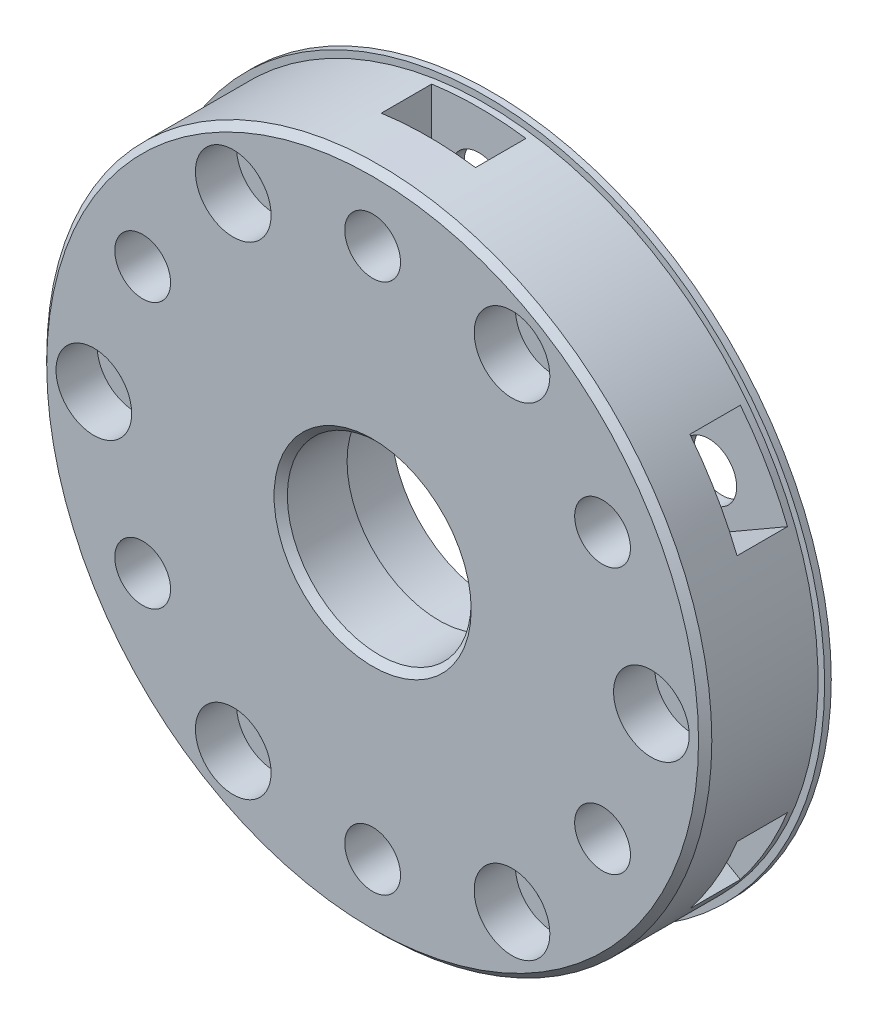
from build123d import *

# Parameters (mm, degrees)
OUTPUT_MASTER_SKETCH_R  = 25.05
BOSS_EXTRUDE1_DEPTH     = 9
SKETCH4_R               = 2.85
CUT_EXTRUDE1_DEPTH      = 4
SKETCH5_R               = 25.55
SKETCH5_R_2             = 25.05
BOSS_EXTRUDE2_DEPTH     = 0.5
SKETCH6_R               = 1.55
CUT_EXTRUDE2_DEPTH      = 38.237145433
CUT_EXTRUDE3_START      = -3.1
SKETCH7_R               = 2.85
CUT_EXTRUDE3_DEPTH      = 3.1
CHAMFER1_SIZE           = 0.5
SKETCH8_R               = 6.925
CUT_EXTRUDE4_DEPTH      = 10
SKETCH9_R               = 7.575
CUT_EXTRUDE5_DEPTH      = 4
SKETCH10_R              = 2.1
M4_THRU_DEPTH           = 38.237145433
CHAMFER3_SIZE           = 0.5
M4_START                = -8
M4_HEXNUT_CUT_DEPTH     = 3.8
SKETCH12_W              = 7.1
SKETCH12_H              = 3.8
M4_HEXNUT_SLOT_DEPTH    = 55.767908461
M4_HEXNUT_PATTERN_COUNT = 6


with BuildPart() as part:
    # Output Master Sketch → Boss-Extrude1 (new body)
    with BuildSketch(Plane.XY):
        Circle(OUTPUT_MASTER_SKETCH_R)
    extrude(amount=BOSS_EXTRUDE1_DEPTH)

    # Sketch4 → Cut-Extrude1 (cut)
    with BuildSketch(Plane.XY):
        with Locations((21, 0)):
            Circle(SKETCH4_R)
        with Locations((10.5, -18.186533479)):
            Circle(SKETCH4_R)
        with Locations((-10.5, -18.186533479)):
            Circle(SKETCH4_R)
        with Locations((-21, 0)):
            Circle(SKETCH4_R)
        with Locations((-10.5, 18.186533479)):
            Circle(SKETCH4_R)
        with Locations((10.5, 18.186533479)):
            Circle(SKETCH4_R)
    extrude(amount=CUT_EXTRUDE1_DEPTH, mode=Mode.SUBTRACT)

    # Sketch5 → Boss-Extrude2 (add)
    with BuildSketch(Plane(origin=(0, 0, 0), x_dir=(-1, 0, 0), z_dir=(0, 0, -1))):
        Circle(SKETCH5_R)
        Circle(SKETCH5_R_2, mode=Mode.SUBTRACT)
    extrude(amount=-BOSS_EXTRUDE2_DEPTH)

    # Sketch6 → Cut-Extrude2 (cut, through all)
    with BuildSketch(Plane(origin=(0, 0, 0), x_dir=(-1, 0, 0), z_dir=(0, 0, -1))):
        with Locations((-21, 0)):
            Circle(SKETCH6_R)
        with Locations((-10.5, 18.186533479)):
            Circle(SKETCH6_R)
        with Locations((10.5, 18.186533479)):
            Circle(SKETCH6_R)
        with Locations((21, 0)):
            Circle(SKETCH6_R)
        with Locations((10.5, -18.186533479)):
            Circle(SKETCH6_R)
        with Locations((-10.5, -18.186533479)):
            Circle(SKETCH6_R)
    extrude(amount=-CUT_EXTRUDE2_DEPTH, mode=Mode.SUBTRACT)

    # Sketch7 → Cut-Extrude3 (cut)
    with BuildSketch(Plane.XY.offset(9).offset(CUT_EXTRUDE3_START)):
        with Locations((-21, 0)):
            Circle(SKETCH7_R)
        with Locations((-10.5, 18.186533479)):
            Circle(SKETCH7_R)
        with Locations((10.5, 18.186533479)):
            Circle(SKETCH7_R)
        with Locations((21, 0)):
            Circle(SKETCH7_R)
        with Locations((10.5, -18.186533479)):
            Circle(SKETCH7_R)
        with Locations((-10.5, -18.186533479)):
            Circle(SKETCH7_R)
    extrude(amount=CUT_EXTRUDE3_DEPTH, mode=Mode.SUBTRACT)

    # Chamfer1
    chamfer1_edges = [part.edges().sort_by_distance(p)[0] for p in [
        (-25.05, 0, 9),
    ]]
    chamfer(chamfer1_edges, length=CHAMFER1_SIZE)

    # Sketch8 → Cut-Extrude4 (cut)
    with BuildSketch(Plane(origin=(0, 0, 0), x_dir=(-1, 0, 0), z_dir=(0, 0, -1))):
        Circle(SKETCH8_R)
    extrude(amount=-CUT_EXTRUDE4_DEPTH, mode=Mode.SUBTRACT)

    # Sketch9 → Cut-Extrude5 (cut)
    with BuildSketch(Plane(origin=(0, 0, 0), x_dir=(-1, 0, 0), z_dir=(0, 0, -1))):
        Circle(SKETCH9_R)
    extrude(amount=-CUT_EXTRUDE5_DEPTH, mode=Mode.SUBTRACT)

    # Sketch10 → M4 Thru (cut, through all)
    with BuildSketch(Plane.XY.offset(9)):
        with Locations((0, 20)):
            Circle(SKETCH10_R)
        with Locations((17.320508076, 10)):
            Circle(SKETCH10_R)
        with Locations((17.320508076, -10)):
            Circle(SKETCH10_R)
        with Locations((0, -20)):
            Circle(SKETCH10_R)
        with Locations((-17.320508076, -10)):
            Circle(SKETCH10_R)
        with Locations((-17.320508076, 10)):
            Circle(SKETCH10_R)
    extrude(amount=-M4_THRU_DEPTH, mode=Mode.SUBTRACT)

    # Chamfer3
    chamfer3_edges = [part.edges().sort_by_distance(p)[0] for p in [
        (6.925, 0, 9),
    ]]
    chamfer(chamfer3_edges, length=CHAMFER3_SIZE)

    # Sketch11 → M4 Hexnut Cut (cut)
    with BuildSketch(Plane.XY.offset(9).offset(M4_START)):
        Polygon((0, 24.099186911), (-3.55, 22.049593456), (-3.55, 17.950406544), (0, 15.900813089), (3.55, 17.950406544), (3.55, 22.049593456), align=None)
    m4_hexnut_cut = extrude(amount=M4_HEXNUT_CUT_DEPTH, mode=Mode.SUBTRACT)

    # Sketch12 → M4 Hexnut Slot (cut, through all)
    with BuildSketch(Plane(origin=(0, 22.049593456, 0), x_dir=(1, 0, 0), z_dir=(0, 1, 0))):
        with Locations((0, -2.9)):
            Rectangle(SKETCH12_W, SKETCH12_H)
    m4_hexnut_slot = extrude(amount=M4_HEXNUT_SLOT_DEPTH, mode=Mode.SUBTRACT)

    # M4 Hexnut Pattern: M4 Hexnut Cut, M4 Hexnut Slot ×6 about axis
    m4_hexnut_pattern_axis = Axis((0, 0, 10), (0, 0, -1))
    add([m4_hexnut_cut.rotate(m4_hexnut_pattern_axis, i * 360 / M4_HEXNUT_PATTERN_COUNT) for i in range(1, M4_HEXNUT_PATTERN_COUNT)], mode=Mode.SUBTRACT)
    add([m4_hexnut_slot.rotate(m4_hexnut_pattern_axis, i * 360 / M4_HEXNUT_PATTERN_COUNT) for i in range(1, M4_HEXNUT_PATTERN_COUNT)], mode=Mode.SUBTRACT)


solid = part.part
